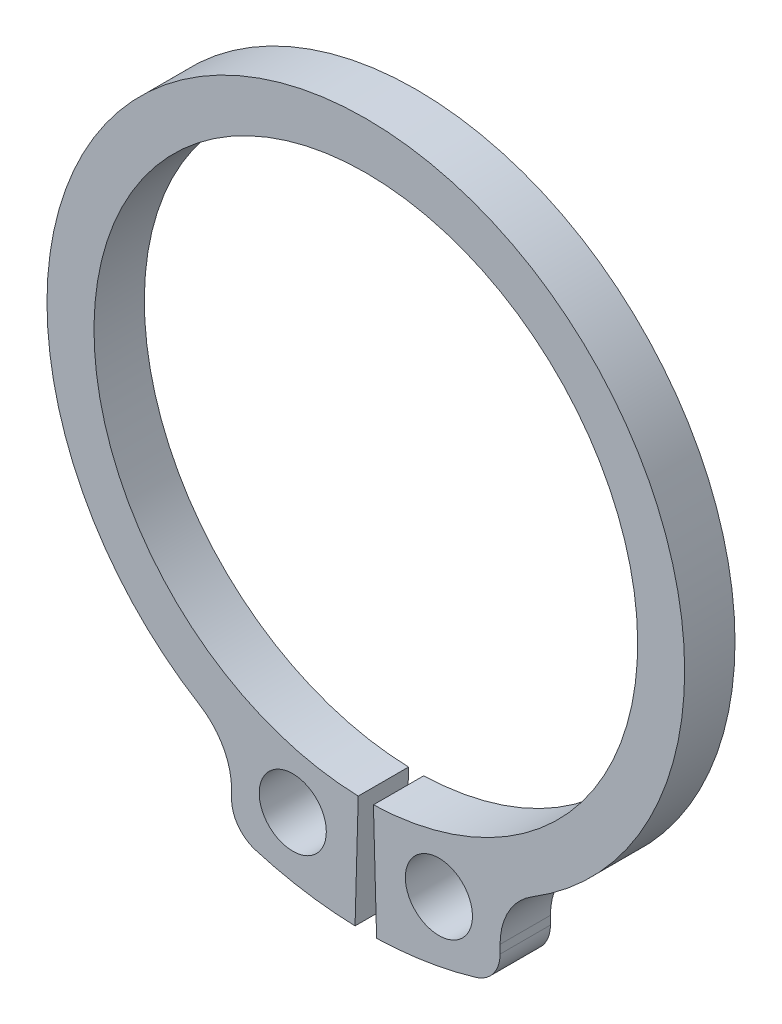
from build123d import *

# Parameters (mm, degrees)
EXTRUDE_1_DEPTH     = 1.5
SKETCH_2_R          = 1
CUT_EXTRUDE_1_DEPTH = 1.5


with BuildPart() as part:
    # Эскиз1 → Бобышка-Вытянуть1 (new body)
    with BuildSketch(Plane.XY):
        with BuildLine():
            Line((-0.321098845, -11.495516323), (-0.226165274, -8.096841932))
            ThreePointArc((-0.226165274, -8.096841932), (0, 8.1), (0.226165274, -8.096841932))
            Line((0.226165274, -8.096841932), (0.321098845, -11.495516323))
            ThreePointArc((0.321098845, -11.495516323), (1.818971328, -11.355234181), (3.285714286, -11.020620746))
            ThreePointArc((3.285714286, -11.020620746), (3.801783726, -10.659920203), (4, -10.062305899))
            Line((4, -10.062305899), (4, -9.810708435))
            ThreePointArc((4, -9.810708435), (4.255443248, -8.832689141), (4.956521739, -8.104498273))
            ThreePointArc((4.956521739, -8.104498273), (0, 9.5), (-4.956521739, -8.104498273))
            ThreePointArc((-4.956521739, -8.104498273), (-4.255443248, -8.832689141), (-4, -9.810708435))
            Line((-4, -9.810708435), (-4, -10.062305899))
            ThreePointArc((-4, -10.062305899), (-3.801783726, -10.659920203), (-3.285714286, -11.020620746))
            ThreePointArc((-3.285714286, -11.020620746), (-1.818971328, -11.355234181), (-0.321098845, -11.495516323))
        make_face()
    extrude(amount=EXTRUDE_1_DEPTH)

    # Эскиз2 → Вырез-Вытянуть1 (cut)
    with BuildSketch(Plane(origin=(0, 0, 0), x_dir=(-1, 0, 0), z_dir=(0, 0, -1))):
        with Locations((-2.177047903, -9.494628436)):
            Circle(SKETCH_2_R)
        with Locations((2.177047903, -9.494628436)):
            Circle(SKETCH_2_R)
    extrude(amount=-CUT_EXTRUDE_1_DEPTH, mode=Mode.SUBTRACT)


solid = part.part
